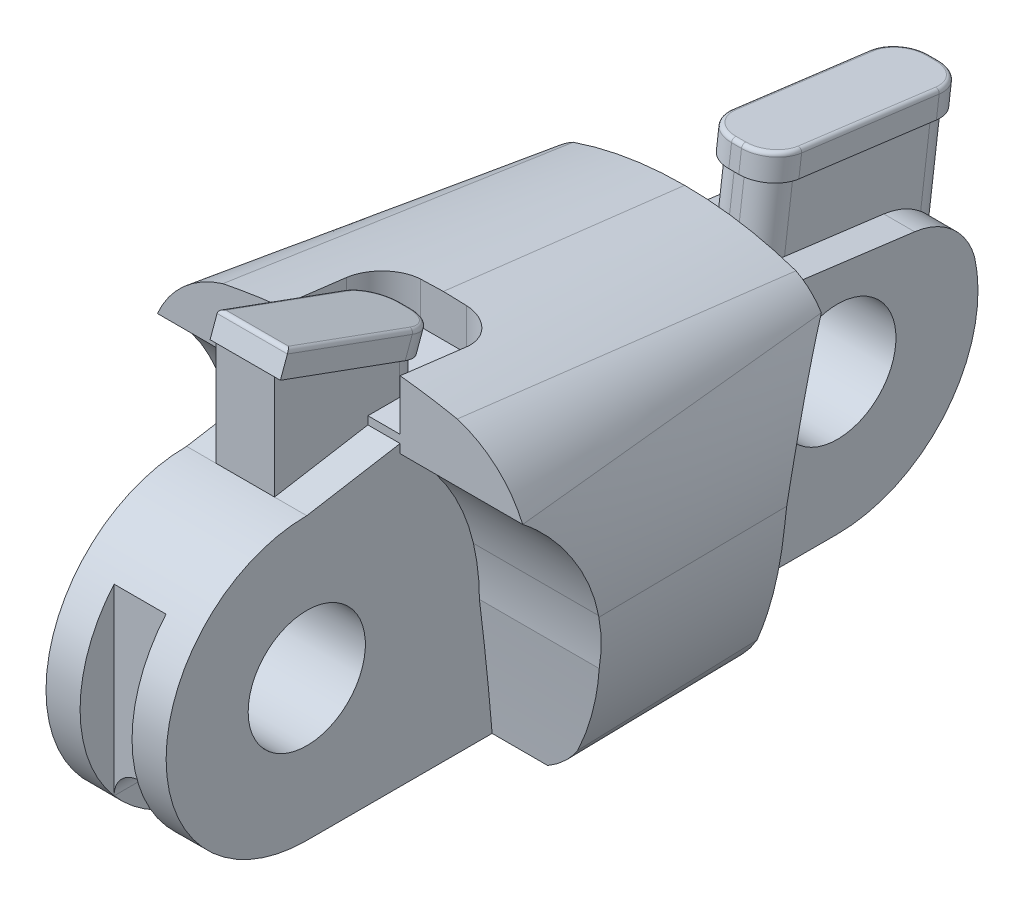
from build123d import *

# Parameters (mm, degrees)
SKETCH1_R           = 3.81
BOSS_EXTRUDE1_DEPTH = 3.90525
CUT_EXTRUDE1_DEPTH  = 10.16
CUT_EXTRUDE2_DEPTH  = 7.8105
CUT_EXTRUDE3_START  = 1.544955
CUT_EXTRUDE3_DEPTH  = 5.08
BOSS_EXTRUDE2_DEPTH = 7.8105
BOSS_EXTRUDE3_START = -1.905
BOSS_EXTRUDE3_DEPTH = 3.81
CUT_EXTRUDE4_REACH  = 37.162
BOSS_EXTRUDE5_DEPTH = 1.58496
BOSS_EXTRUDE6_START = -1.905
BOSS_EXTRUDE6_DEPTH = 6.223
BOSS_EXTRUDE7_DEPTH = 1.6383
FILLET1_R           = 0.254
SKETCH16_W          = 3.3782
SKETCH16_H          = 2.2098
CUT_EXTRUDE5_DEPTH  = 19.832955
CUT_EXTRUDE6_DEPTH  = 17.76984
SKETCH18_R          = 1.6891
CUT_EXTRUDE7_DEPTH  = 40.90500812


with BuildPart() as part:
    # Sketch1 → Boss-Extrude1 (new, symmetric)
    with BuildSketch(Plane(origin=(0, 0, 0), x_dir=(0, 0, -1), z_dir=(1, 0, 0))):
        with BuildLine():
            Line((-17.249775, 9.144), (17.249775, 9.144))
            ThreePointArc((17.249775, 9.144), (26.393775, 0), (17.249775, -9.144))
            Line((17.249775, -9.144), (-17.249775, -9.144))
            ThreePointArc((-17.249775, -9.144), (-26.393775, 0), (-17.249775, 9.144))
        make_face()
        with Locations(Location((-17.249775, 0, 0), (0, 0, 180))):
            Circle(SKETCH1_R, mode=Mode.SUBTRACT)
        with Locations(Location((17.249775, 0, 0), (0, 0, 180))):
            Circle(SKETCH1_R, mode=Mode.SUBTRACT)
    extrude(amount=BOSS_EXTRUDE1_DEPTH, both=True)

    # Sketch6 → Cut-Extrude2 (cut)
    with BuildSketch(Plane.ZY.offset(3.90525)):
        with BuildLine():
            Line((-11.223625, 6.794562232), (-22.272625, 5.371311745))
            ThreePointArc((-22.272625, 5.371311745), (-24.727401331, 4.274829252), (-26.170875979, 2.006662232))
            Line((-26.170875979, 2.006662232), (-26.170875979, 11.557062232))
            Line((-26.170875979, 11.557062232), (-11.223625, 11.557062232))
            Line((-11.223625, 11.557062232), (-11.223625, 6.794562232))
        make_face()
    extrude(amount=-CUT_EXTRUDE2_DEPTH, mode=Mode.SUBTRACT)



with BuildPart() as body_2:
    # Sketch2 for Loft1 → Loft1 section 0
    with BuildSketch(Plane.XY.offset(11.179175)):
        with BuildLine():
            Line((7.62, -9.144), (-7.62, -9.144))
            # circular arc as an exact rational Bezier (weights 1, cos(half-angle), 1)
            Bezier((-7.62, -9.144), (-8.823347275, -8.445569328), (-9.652, -7.3279), weights=[1, 0.979372642, 1])
            Bezier((-9.652, -7.3279), (-12.134201004, -2.839612101), (-12.319, 2.286), weights=[1, 0.972614901, 1])
            Bezier((-12.319, 2.286), (-12.567140486, 5.972182755), (-11.8745, 9.6012), weights=[1, 0.991831397, 1])
            Bezier((-11.8745, 9.6012), (-10.629580734, 12.49146932), (-7.62, 13.4112), weights=[1, 0.907396745, 1])
            Bezier((-7.62, 13.4112), (-3.848366605, 14.177286926), (0, 14.224), weights=[1, 0.99557332, 1])
            Bezier((0, 14.224), (3.848366605, 14.177286926), (7.62, 13.4112), weights=[1, 0.99557332, 1])
            Bezier((7.62, 13.4112), (10.629580734, 12.49146932), (11.8745, 9.6012), weights=[1, 0.907396745, 1])
            Bezier((11.8745, 9.6012), (12.567140486, 5.972182755), (12.319, 2.286), weights=[1, 0.991831397, 1])
            Bezier((12.319, 2.286), (12.134201004, -2.839612101), (9.652, -7.3279), weights=[1, 0.972614901, 1])
            Bezier((9.652, -7.3279), (8.823347275, -8.445569328), (7.62, -9.144), weights=[1, 0.979372642, 1])
        make_face()
    # Sketch3 for Loft1 → Loft1 section 1
    with BuildSketch(Plane.XY.offset(-11.223625)):
        with BuildLine():
            Line((7.239, -9.144), (-7.239, -9.144))
            Bezier((-7.239, -9.144), (-8.753841253, -8.175778777), (-9.6266, -6.604), weights=[1, 0.969503081, 1])
            Bezier((-9.6266, -6.604), (-11.173123964, -2.849606771), (-10.9855, 1.2065), weights=[1, 0.976227242, 1])
            Bezier((-10.9855, 1.2065), (-11.039539394, 5.319492083), (-8.89, 8.8265), weights=[1, 0.960638668, 1])
            Bezier((-8.89, 8.8265), (-8.278279991, 9.824530982), (-7.239, 10.3632), weights=[1, 0.963404835, 1])
            Bezier((-7.239, 10.3632), (-3.719392538, 11.565831349), (0, 11.557), weights=[1, 0.986284059, 1])
            Bezier((0, 11.557), (3.719392538, 11.565831349), (7.239, 10.3632), weights=[1, 0.986284059, 1])
            Bezier((7.239, 10.3632), (8.278279991, 9.824530982), (8.89, 8.8265), weights=[1, 0.963404835, 1])
            Bezier((8.89, 8.8265), (11.039539394, 5.319492083), (10.9855, 1.2065), weights=[1, 0.960638668, 1])
            Bezier((10.9855, 1.2065), (11.173123964, -2.849606771), (9.6266, -6.604), weights=[1, 0.976227242, 1])
            Bezier((9.6266, -6.604), (8.753841253, -8.175778777), (7.239, -9.144), weights=[1, 0.969503081, 1])
        make_face()
    loft()

    # Sketch5 → Cut-Extrude1 (cut)
    with BuildSketch(Plane.ZY.offset(3.90525)):
        with BuildLine():
            Line((11.179175, 9.6012), (11.179175, -9.144))
            Line((11.179175, -9.144), (5.197475, -9.144))
            ThreePointArc((5.197475, -9.144), (5.569320978, -5.158943875), (6.022975, -1.18237))
            ThreePointArc((6.022975, -1.18237), (6.122991349, 0.505179093), (6.414135, 2.17043))
            ThreePointArc((6.414135, 2.17043), (8.158546966, 6.295006821), (11.179175, 9.6012))
        make_face()
        with BuildLine():
            Line((-11.223625, 8.8265), (-11.223625, -9.144))
            Line((-11.223625, -9.144), (-6.461125, -9.144))
            ThreePointArc((-6.461125, -9.144), (-6.245836434, -4.370705), (-6.461125, 0.40259))
            ThreePointArc((-6.461125, 0.40259), (-7.934911905, 5.127583837), (-11.223625, 8.8265))
        make_face()
    cut_extrude1 = extrude(amount=CUT_EXTRUDE1_DEPTH, mode=Mode.SUBTRACT)

    # Mirror1: Cut-Extrude1 across plane
    add(cut_extrude1.mirror(Plane(origin=(0, 0, 0), x_dir=(0, 0, 1), z_dir=(1, 0, 0))), mode=Mode.SUBTRACT)

    # Sketch7 → Cut-Extrude3 (cut)
    with BuildSketch(Plane(origin=(0, 9.144, 0), x_dir=(1, 0, 0), z_dir=(0, 1, 0)).offset(CUT_EXTRUDE3_START)):
        with BuildLine():
            Line((-3.90525, -11.179175), (3.90525, -11.179175))
            Line((3.90525, -11.179175), (3.90525, -6.861175))
            ThreePointArc((3.90525, -6.861175), (3.199972368, -5.161660046), (1.4986, -4.460875))
            Line((1.4986, -4.460875), (-1.4986, -4.460875))
            ThreePointArc((-1.4986, -4.460875), (-3.199972368, -5.161660046), (-3.90525, -6.861175))
            Line((-3.90525, -6.861175), (-3.90525, -11.179175))
        make_face()
    extrude(amount=CUT_EXTRUDE3_DEPTH, mode=Mode.SUBTRACT)


with BuildPart() as part_1:
    add(part.part)

    add(body_2.part)  # Boss-Extrude2 merges body 2
    # Sketch8 → Boss-Extrude2 (add)
    with BuildSketch(Plane.ZY.offset(3.90525)):
        Polygon((11.179175, 9.144), (17.249775, 9.144), (11.179175, 10.1727), align=None)
    extrude(amount=-BOSS_EXTRUDE2_DEPTH)

    # Sketch9 → Boss-Extrude3 (add)
    with BuildSketch(Plane.ZY.offset(3.90525).offset(BOSS_EXTRUDE3_START)):
        Polygon((17.249775, 9.144), (17.249775, 15.91056), (-1.341195807, 9.144), align=None)
    extrude(amount=-BOSS_EXTRUDE3_DEPTH)

    # Cut-Extrude4: up to this plane
    cut_extrude4_end = Plane(origin=(1.80975, 15.91056, 17.249775), z_dir=(0, 0.9396926207859105, -0.3420201433256631))
    # Sketch11 → Cut-Extrude4 (cut, up to the surface)
    with BuildSketch(Plane(origin=(0, 10.688955, 0), x_dir=(1, 0, 0), z_dir=(0, 1, 0)), mode=Mode.PRIVATE) as cut_extrude4_sk1:
        with BuildLine():
            Line((-2.00025, -9.134589527), (-3.90525, -9.134589527))
            Line((-3.90525, -9.134589527), (-3.90525, -6.861175))
            ThreePointArc((-3.90525, -6.861175), (-3.198114954, -5.163522374), (-1.4986, -4.460875))
            Line((-1.4986, -4.460875), (1.4986, -4.460875))
            ThreePointArc((1.4986, -4.460875), (3.199972368, -5.161660046), (3.90525, -6.861175))
            Line((3.90525, -6.861175), (3.90525, -9.134589527))
            Line((3.90525, -9.134589527), (1.80975, -9.134589527))
            ThreePointArc((1.80975, -9.134589527), (1.313452763, -8.078528179), (0.2286, -7.64879454))
            Line((0.2286, -7.64879454), (-0.4191, -7.64879454))
            ThreePointArc((-0.4191, -7.64879454), (-1.531007843, -8.049736764), (-2.00025, -9.134589527))
        make_face()
    cut_extrude4_tool1 = split(extrude(cut_extrude4_sk1.sketch, amount=CUT_EXTRUDE4_REACH, mode=Mode.PRIVATE), bisect_by=cut_extrude4_end, keep=Keep.BOTH, mode=Mode.PRIVATE)
    add(cut_extrude4_tool1.solids().sort_by_distance((0.018699, 10.688955, 6.683286))[0], mode=Mode.SUBTRACT)

    # Sketch12 → Boss-Extrude5 (add)
    with BuildSketch(Plane(origin=(0, 8.505407218, -3.095715057), x_dir=(1, 0, 0), z_dir=(0, 0.9396926207859104, -0.34202014332566316))):
        with BuildLine():
            Line((1.80975, -21.651218289), (2.19075, -21.651218289))
            Line((2.19075, -21.651218289), (2.19075, -13.015218289))
            ThreePointArc((2.19075, -13.015218289), (1.616049571, -11.627768719), (0.2286, -11.053068289))
            Line((0.2286, -11.053068289), (-0.4191, -11.053068289))
            ThreePointArc((-0.4191, -11.053068289), (-1.806549571, -11.627768719), (-2.38125, -13.015218289))
            Line((-2.38125, -13.015218289), (-2.38125, -21.651218289))
            Line((-2.38125, -21.651218289), (-2.00025, -21.651218289))
            Line((-2.00025, -21.651218289), (1.80975, -21.651218289))
        make_face()
    extrude(amount=BOSS_EXTRUDE5_DEPTH)

    # Sketch13 → Boss-Extrude6 (add)
    with BuildSketch(Plane(origin=(0, 8.105809457, -1.044130443), x_dir=(1, 0, 0), z_dir=(0, 0.9918054930472712, -0.1277570505344408)).offset(BOSS_EXTRUDE6_START)):
        with BuildLine():
            Line((-0.32385, 13.311599696), (0.32385, 13.311599696))
            ThreePointArc((0.32385, 13.311599696), (1.441891887, 13.774707809), (1.905, 14.892749696))
            Line((1.905, 14.892749696), (1.905, 23.909749696))
            ThreePointArc((1.905, 23.909749696), (1.441891887, 25.027791583), (0.32385, 25.490899696))
            Line((0.32385, 25.490899696), (-0.32385, 25.490899696))
            ThreePointArc((-0.32385, 25.490899696), (-1.441891887, 25.027791583), (-1.905, 23.909749696))
            Line((-1.905, 23.909749696), (-1.905, 14.892749696))
            ThreePointArc((-1.905, 14.892749696), (-1.441891887, 13.774707809), (-0.32385, 13.311599696))
        make_face()
    extrude(amount=BOSS_EXTRUDE6_DEPTH)

    # Sketch14 → Boss-Extrude7 (add)
    with BuildSketch(Plane(origin=(0, 12.388425576, -1.595785387), x_dir=(1, 0, 0), z_dir=(0, 0.991805493047271, -0.12775705053444084))):
        with BuildLine():
            Line((0.32385, 12.930599696), (-0.32385, 12.930599696))
            ThreePointArc((-0.32385, 12.930599696), (-1.711299571, 13.505300126), (-2.286, 14.892749696))
            Line((-2.286, 14.892749696), (-2.286, 23.909749696))
            ThreePointArc((-2.286, 23.909749696), (-1.711299571, 25.297199267), (-0.32385, 25.871899696))
            Line((-0.32385, 25.871899696), (0.32385, 25.871899696))
            ThreePointArc((0.32385, 25.871899696), (1.711299571, 25.297199267), (2.286, 23.909749696))
            Line((2.286, 23.909749696), (2.286, 14.892749696))
            ThreePointArc((2.286, 14.892749696), (1.711299571, 13.505300126), (0.32385, 12.930599696))
        make_face()
    extrude(amount=BOSS_EXTRUDE7_DEPTH)

    # Fillet1
    fillet1_edges = [part_1.edges().sort_by_distance(p)[0] for p in [
        (-0.09525, 17.399935216, 16.707686754),
        (2.19075, 15.923092237, 12.650094017),
        (1.616049571, 13.971713557, 7.288725157),
        (-0.09525, 13.775154434, 6.748683405),
        (-1.806549571, 13.971713557, 7.288725157),
        (-2.38125, 15.923092237, 12.650094017),
        (1.711299571, 12.287903205, -15.199720613),
        (2.286, 11.534654078, -21.047355784),
        (1.711299571, 10.781404951, -26.894990955),
        (0, 10.707982919, -27.464981997),
        (-1.711299571, 10.781404951, -26.894990955),
        (-2.286, 11.534654078, -21.047355784),
        (-1.711299571, 12.287903205, -15.199720613),
        (0, 12.361325237, -14.62972957),
    ]]
    fillet(fillet1_edges, radius=FILLET1_R)

    # Sketch16 → Cut-Extrude5 (cut)
    with BuildSketch(Plane.XZ.offset(9.144)):
        with Locations((0, 25.288875)):
            Rectangle(SKETCH16_W, SKETCH16_H)
    extrude(amount=-CUT_EXTRUDE5_DEPTH, mode=Mode.SUBTRACT)

    # Sketch17 → Cut-Extrude6 (cut)
    with BuildSketch(Plane.XY.offset(24.183975)):
        with BuildLine():
            Line((-1.6891, -5.960671637), (-1.6891, -9.144))
            Line((-1.6891, -9.144), (1.6891, -9.144))
            Line((1.6891, -9.144), (1.6891, -5.960671637))
            ThreePointArc((1.6891, -5.960671637), (0, -4.271571637), (-1.6891, -5.960671637))
        make_face()
    cut_extrude6 = extrude(amount=-CUT_EXTRUDE6_DEPTH, mode=Mode.SUBTRACT)

    # Mirror2: Cut-Extrude6 across plane
    add(cut_extrude6.mirror(Plane.XY), mode=Mode.SUBTRACT)

    # Sketch18 → Cut-Extrude7 (cut, through all)
    with BuildSketch(Plane.XY.offset(6.414135)):
        with Locations((0, -5.960671637)):
            Circle(SKETCH18_R)
    extrude(amount=-CUT_EXTRUDE7_DEPTH, mode=Mode.SUBTRACT)


solid = part_1.part
